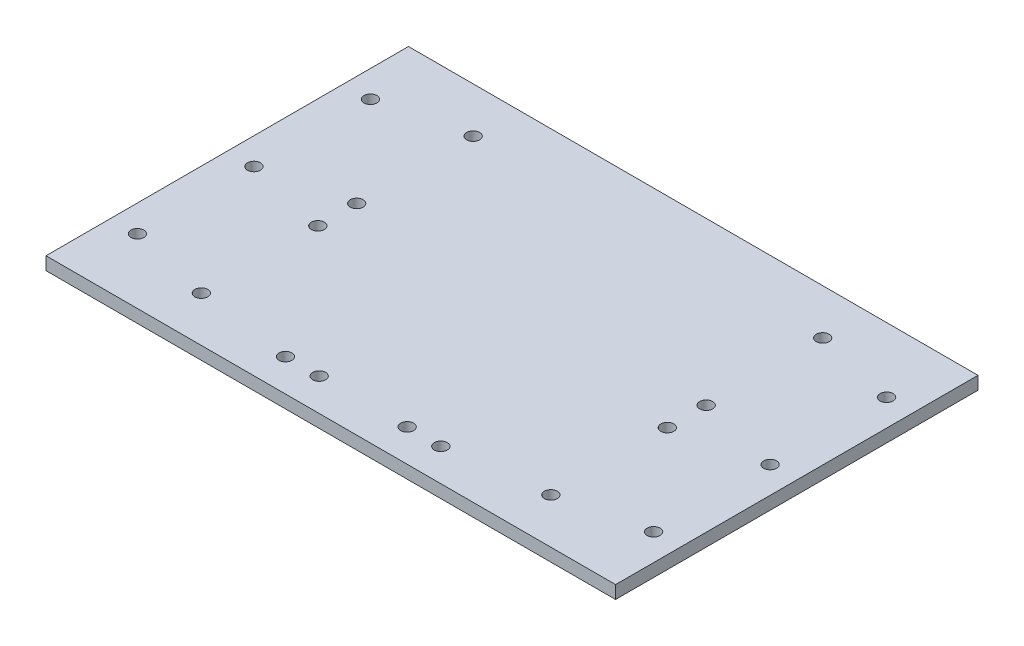
from build123d import *

# Parameters (mm, degrees)
SKETCH2_W           = 279.4
SKETCH2_H           = 177.8
SKETCH2_R           = 3.175
BOSS_EXTRUDE1_DEPTH = 6.35
SKETCH3_R           = 3.175
CUT_EXTRUDE1_DEPTH  = 166.709452054
SKETCH4_R           = 3.175
CUT_EXTRUDE2_DEPTH  = 166.709452054


with BuildPart() as part:
    # Sketch2 → Boss-Extrude1 (new body)
    with BuildSketch(Plane(origin=(0, 0, 0), x_dir=(1, 0, 0), z_dir=(0, 1, 0))):
        Rectangle(SKETCH2_W, SKETCH2_H)
        with Locations((-21.59, -73.025)):
            Circle(SKETCH2_R, mode=Mode.SUBTRACT)
        with Locations((-38.1, -73.025)):
            Circle(SKETCH2_R, mode=Mode.SUBTRACT)
        with Locations((38.1, -73.025)):
            Circle(SKETCH2_R, mode=Mode.SUBTRACT)
        with Locations((21.59, -73.025)):
            Circle(SKETCH2_R, mode=Mode.SUBTRACT)
    extrude(amount=BOSS_EXTRUDE1_DEPTH)

    # Sketch3 → Cut-Extrude1 (cut, through all)
    with BuildSketch(Plane(origin=(0, 6.35, 0), x_dir=(1, 0, 0), z_dir=(0, 1, 0))):
        with Locations((-126.619, 57.15)):
            Circle(SKETCH3_R)
        with Locations((-126.619, -57.15)):
            Circle(SKETCH3_R)
        with Locations((126.619, -57.15)):
            Circle(SKETCH3_R)
        with Locations((126.619, 0)):
            Circle(SKETCH3_R)
        with Locations((126.619, 57.15)):
            Circle(SKETCH3_R)
        with Locations((-126.619, 0)):
            Circle(SKETCH3_R)
    extrude(amount=-CUT_EXTRUDE1_DEPTH, mode=Mode.SUBTRACT)

    # Sketch4 → Cut-Extrude2 (cut, through all)
    with BuildSketch(Plane.XZ):
        with Locations((-85.725, 66.675)):
            Circle(SKETCH4_R)
        with Locations((-85.725, -66.675)):
            Circle(SKETCH4_R)
        with Locations((85.725, -66.675)):
            Circle(SKETCH4_R)
        with Locations((85.725, -9.525)):
            Circle(SKETCH4_R)
        with Locations((85.725, 9.525)):
            Circle(SKETCH4_R)
        with Locations((85.725, 66.675)):
            Circle(SKETCH4_R)
        with Locations((-85.725, 9.525)):
            Circle(SKETCH4_R)
        with Locations((-85.725, -9.525)):
            Circle(SKETCH4_R)
    extrude(amount=-CUT_EXTRUDE2_DEPTH, mode=Mode.SUBTRACT)


solid = part.part
